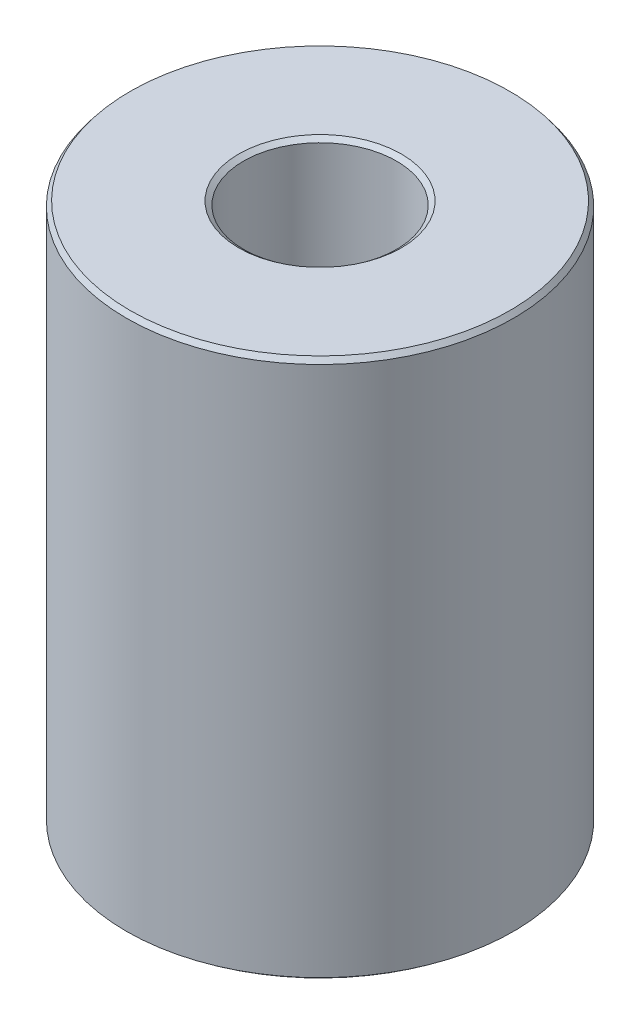
from build123d import *
from OCP.BRepFilletAPI import BRepFilletAPI_MakeChamfer

# Parameters (mm, degrees)
SKETCH1_R           = 47.5
BOSS_EXTRUDE1_DEPTH = 132.421435389
SKETCH2_R           = 18.780557571
CUT_EXTRUDE1_DEPTH  = 149.485475891
CHAMFER1_SIZE       = 1.1867474
CHAMFER1_SIZE2      = 0.906216101


with BuildPart() as part:
    # Sketch1 → Boss-Extrude1 (new body)
    with BuildSketch(Plane(origin=(0, 0, 0), x_dir=(1, 0, 0), z_dir=(0, 1, 0))):
        Circle(SKETCH1_R)
    extrude(amount=BOSS_EXTRUDE1_DEPTH)

    # Sketch2 → Cut-Extrude1 (cut, through all)
    with BuildSketch(Plane(origin=(0, 0, 0), x_dir=(1, 0, 0), z_dir=(0, 1, 0))):
        Circle(SKETCH2_R)
    extrude(amount=CUT_EXTRUDE1_DEPTH, mode=Mode.SUBTRACT)

    # Chamfer1: one chamfer whose edges measure the first distance from different faces: ONE call of the kernel's chamfer builder (chamfer() names one face for all edges)
    chamfer1_edges_1 = [part.edges().sort_by_distance(p)[0] for p in [
        (-18.780557571, 132.421435389, 0),
    ]]
    chamfer1_side_1 = [part.faces().sort_by_distance(p)[0] for p in [
        (-46.156497116, 132.421435389, 0),
    ]]
    chamfer1_edges_2 = [part.edges().sort_by_distance(p)[0] for p in [
        (-18.780557571, 0, 0),
    ]]
    chamfer1_side_2 = [part.faces().sort_by_distance(p)[0] for p in [
        (-18.780557571, 66.210717695, 0),
    ]]
    chamfer1_edges_3 = [part.edges().sort_by_distance(p)[0] for p in [
        (-47.5, 0, 0),
    ]]
    chamfer1_side_3 = [part.faces().sort_by_distance(p)[0] for p in [
        (-46.156497116, 0, 0),
    ]]
    chamfer1_edges_4 = [part.edges().sort_by_distance(p)[0] for p in [
        (-47.5, 132.421435389, 0),
    ]]
    chamfer1_side_4 = [part.faces().sort_by_distance(p)[0] for p in [
        (-47.5, 66.210717695, 0),
    ]]
    chamfer1 = BRepFilletAPI_MakeChamfer(part.part.solid().wrapped)
    for e in chamfer1_edges_1:
        chamfer1.Add(CHAMFER1_SIZE, CHAMFER1_SIZE2, e.wrapped, chamfer1_side_1[0].wrapped)  # the first distance lies on this face
    for e in chamfer1_edges_2:
        chamfer1.Add(CHAMFER1_SIZE, CHAMFER1_SIZE2, e.wrapped, chamfer1_side_2[0].wrapped)  # the first distance lies on this face
    for e in chamfer1_edges_3:
        chamfer1.Add(CHAMFER1_SIZE, CHAMFER1_SIZE2, e.wrapped, chamfer1_side_3[0].wrapped)  # the first distance lies on this face
    for e in chamfer1_edges_4:
        chamfer1.Add(CHAMFER1_SIZE, CHAMFER1_SIZE2, e.wrapped, chamfer1_side_4[0].wrapped)  # the first distance lies on this face
    add(Compound.cast(chamfer1.Shape()), mode=Mode.REPLACE)


solid = part.part
